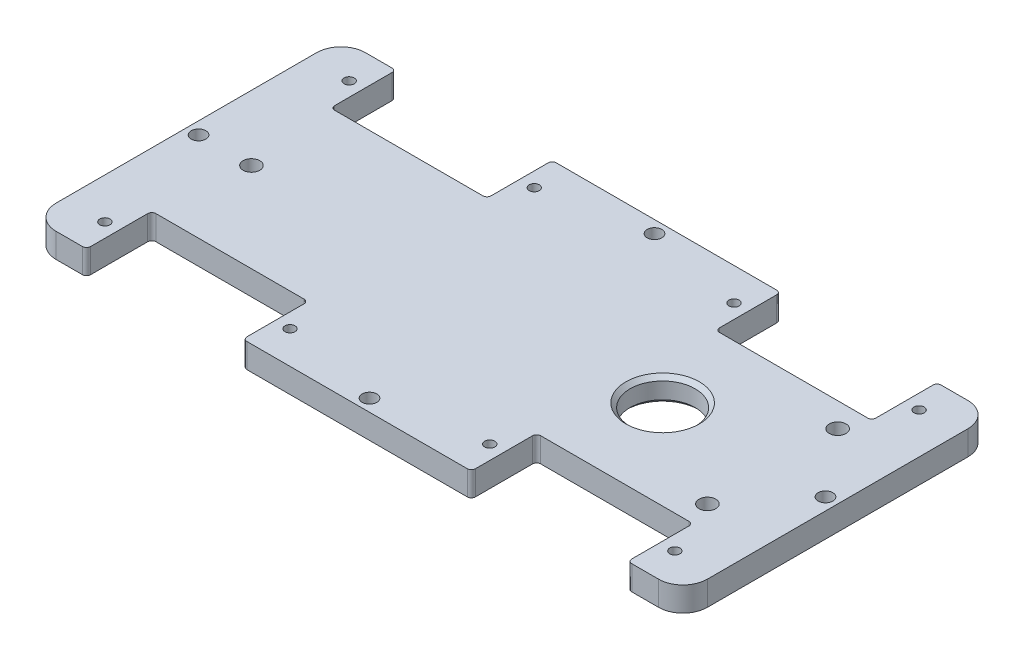
from build123d import *

# Parameters (mm, degrees)
SKETCH1_W                    = 80
SKETCH1_H                    = 38
BOSS_EXTRUDE1_DEPTH          = 3
M1_6X0_35_TAPPED_HOLE1_D     = 1.25
M1_6X0_35_TAPPED_HOLE1_DEPTH = 4.95
M1_6X0_35_TAPPED_HOLE1_TIP   = 0.375537887
FILLET1_R                    = 3
SKETCH6_W                    = 19.2
SKETCH6_H                    = 8.035
CUT_EXTRUDE1_DEPTH           = 45.384682042
FILLET2_R                    = 0.5
LPATTERN1_COUNT              = 2
LPATTERN1_PITCH              = 47.267
FILLET2_OF_LPATTERN1_R       = 0.5
MIRROR1_DEPTH                = 3
M1_6_CLEARANCE_HOLE3_D       = 1.8
M1_6_CLEARANCE_HOLE3_DEPTH   = 4.25
M1_6_CLEARANCE_HOLE3_TIP     = 0.540774557
M2_5X0_45_TAPPED_HOLE1_D     = 2.05
M2_5X0_45_TAPPED_HOLE1_DEPTH = 7.25
M2_5X0_45_TAPPED_HOLE1_TIP   = 0.615882135
CUT_EXTRUDE2_DEPTH           = 45.384682042
CUT_EXTRUDE2_DEPTH_BACK      = 45.384682042
SKETCH16_R                   = 4
CHAMFER1_SIZE                = 0.5


# Read off the part's stored shape, not the designer's step: Mirror1
with BuildPart() as part:
    # Sketch1 → Boss-Extrude1 (new body)
    with BuildSketch(Plane(origin=(0, 0, 0), x_dir=(1, 0, 0), z_dir=(0, 1, 0))):
        Rectangle(SKETCH1_W, SKETCH1_H)
    extrude(amount=BOSS_EXTRUDE1_DEPTH)

    # M1.6x0.35 Tapped Hole1
    with Locations(Plane(origin=(0, 3, 0), x_dir=(1, 0, 0), z_dir=(0, 1, 0))):
        with Locations((-35, 15), (-12.267, 15), (-12.267, -15), (-35, -15), (12.267, -15), (35, -15), (35, 15), (12.267, 15)):
            Hole(M1_6X0_35_TAPPED_HOLE1_D / 2, depth=M1_6X0_35_TAPPED_HOLE1_DEPTH)
            with Locations((0, 0, -(M1_6X0_35_TAPPED_HOLE1_DEPTH + M1_6X0_35_TAPPED_HOLE1_TIP / 2))):  # 118° drill point
                Cone(0, M1_6X0_35_TAPPED_HOLE1_D / 2, M1_6X0_35_TAPPED_HOLE1_TIP, mode=Mode.SUBTRACT)

    # Fillet1
    fillet1_edges = [part.edges().sort_by_distance(p)[0] for p in [
        (40, 1.5, 19),
        (-40, 1.5, 19),
        (-40, 1.5, -19),
        (40, 1.5, -19),
    ]]
    fillet(fillet1_edges, radius=FILLET1_R)

    # Sketch6 → Cut-Extrude1 (cut, symmetric)
    with BuildSketch(Plane.XZ):
        with Locations((-23.657734471, -15)):
            Rectangle(SKETCH6_W, SKETCH6_H)
    cut_extrude1 = extrude(amount=CUT_EXTRUDE1_DEPTH, both=True, mode=Mode.SUBTRACT)

    # Fillet2
    fillet2_edges = [part.edges().sort_by_distance(p)[0] for p in [
        (-33.257734471, 1.5, -19),
        (-14.057734471, 1.5, -10.9825),
        (-33.257734471, 1.5, -10.9825),
        (-14.057734471, 1.5, -19),
    ]]
    fillet(fillet2_edges, radius=FILLET2_R)

    # LPattern1: Cut-Extrude1 ×2
    with Locations(*[(i * LPATTERN1_PITCH, 0, 0) for i in range(1, LPATTERN1_COUNT)]):
        add(cut_extrude1, mode=Mode.SUBTRACT)

    # Fillet2 of LPattern1
    fillet2_of_lpattern1_edges = [part.edges().sort_by_distance(p)[0] for p in [
        (14.009265529, 1.5, -19),
        (33.209265529, 1.5, -10.9825),
        (14.009265529, 1.5, -10.9825),
        (33.209265529, 1.5, -19),
    ]]
    fillet(fillet2_of_lpattern1_edges, radius=FILLET2_OF_LPATTERN1_R)

    # Mirror1 outline → Mirror1 (cut)
    with BuildSketch(Plane(origin=(0, 0, 0), x_dir=(1, 0, 0), z_dir=(0, 1, 0))):
        with BuildLine():
            ThreePointArc((-32.757734471, -10.9825), (-33.111287862, -11.128946609), (-33.257734471, -11.4825))
            Line((-33.257734471, -11.4825), (-33.257734471, -18.5))
            ThreePointArc((-33.257734471, -18.5), (-33.40418108, -18.853553391), (-33.757734471, -19))
            Line((-33.757734471, -19), (-13.557734471, -19))
            ThreePointArc((-13.557734471, -19), (-13.911287861, -18.853553391), (-14.057734471, -18.5))
            Line((-14.057734471, -18.5), (-14.057734471, -11.4825))
            ThreePointArc((-14.057734471, -11.4825), (-14.20418108, -11.128946609), (-14.557734471, -10.9825))
            Line((-14.557734471, -10.9825), (-32.757734471, -10.9825))
        make_face()
        with BuildLine():
            ThreePointArc((14.009265529, -18.5), (13.86281892, -18.853553391), (13.509265529, -19))
            Line((13.509265529, -19), (33.709265529, -19))
            ThreePointArc((33.709265529, -19), (33.355712139, -18.853553391), (33.209265529, -18.5))
            Line((33.209265529, -18.5), (33.209265529, -11.4825))
            ThreePointArc((33.209265529, -11.4825), (33.06281892, -11.128946609), (32.709265529, -10.9825))
            Line((32.709265529, -10.9825), (14.509265529, -10.9825))
            ThreePointArc((14.509265529, -10.9825), (14.155712139, -11.128946609), (14.009265529, -11.4825))
            Line((14.009265529, -11.4825), (14.009265529, -18.5))
        make_face()
    extrude(amount=MIRROR1_DEPTH, mode=Mode.SUBTRACT)

    # M1.6 Clearance Hole3
    with Locations(Plane(origin=(0, 3, 0), x_dir=(1, 0, 0), z_dir=(0, 1, 0))):
        with Locations((-38.5, 0), (0, 17.5), (38.5, 0), (0, -17.5)):
            Hole(M1_6_CLEARANCE_HOLE3_D / 2, depth=M1_6_CLEARANCE_HOLE3_DEPTH)
            with Locations((0, 0, -(M1_6_CLEARANCE_HOLE3_DEPTH + M1_6_CLEARANCE_HOLE3_TIP / 2))):  # 118° drill point
                Cone(0, M1_6_CLEARANCE_HOLE3_D / 2, M1_6_CLEARANCE_HOLE3_TIP, mode=Mode.SUBTRACT)

    # M2.5x0.45 Tapped Hole1
    with Locations(Plane(origin=(0, 3, 0), x_dir=(1, 0, 0), z_dir=(0, 1, 0))):
        with Locations((32, 8), (32, -8), (-32, 0)):
            Hole(M2_5X0_45_TAPPED_HOLE1_D / 2, depth=M2_5X0_45_TAPPED_HOLE1_DEPTH)
            with Locations((0, 0, -(M2_5X0_45_TAPPED_HOLE1_DEPTH + M2_5X0_45_TAPPED_HOLE1_TIP / 2))):  # 118° drill point
                Cone(0, M2_5X0_45_TAPPED_HOLE1_D / 2, M2_5X0_45_TAPPED_HOLE1_TIP, mode=Mode.SUBTRACT)

    # Sketch16 → Cut-Extrude2 (cut, two sides: drawn at the far end of the back side and taken through both)
    with BuildSketch(Plane(origin=(0, 3, 0), x_dir=(1, 0, 0), z_dir=(0, 1, 0)).offset(-CUT_EXTRUDE2_DEPTH_BACK)):
        with Locations(Location((18.5, 0, 0), (0, 0, 270))):
            Circle(SKETCH16_R)
    extrude(amount=CUT_EXTRUDE2_DEPTH + CUT_EXTRUDE2_DEPTH_BACK, mode=Mode.SUBTRACT)

    # Chamfer1
    chamfer1_edges = [part.edges().sort_by_distance(p)[0] for p in [
        (18.5, 0, -4),
        (18.5, 3, -4),
    ]]
    chamfer(chamfer1_edges, length=CHAMFER1_SIZE)


solid = part.part
